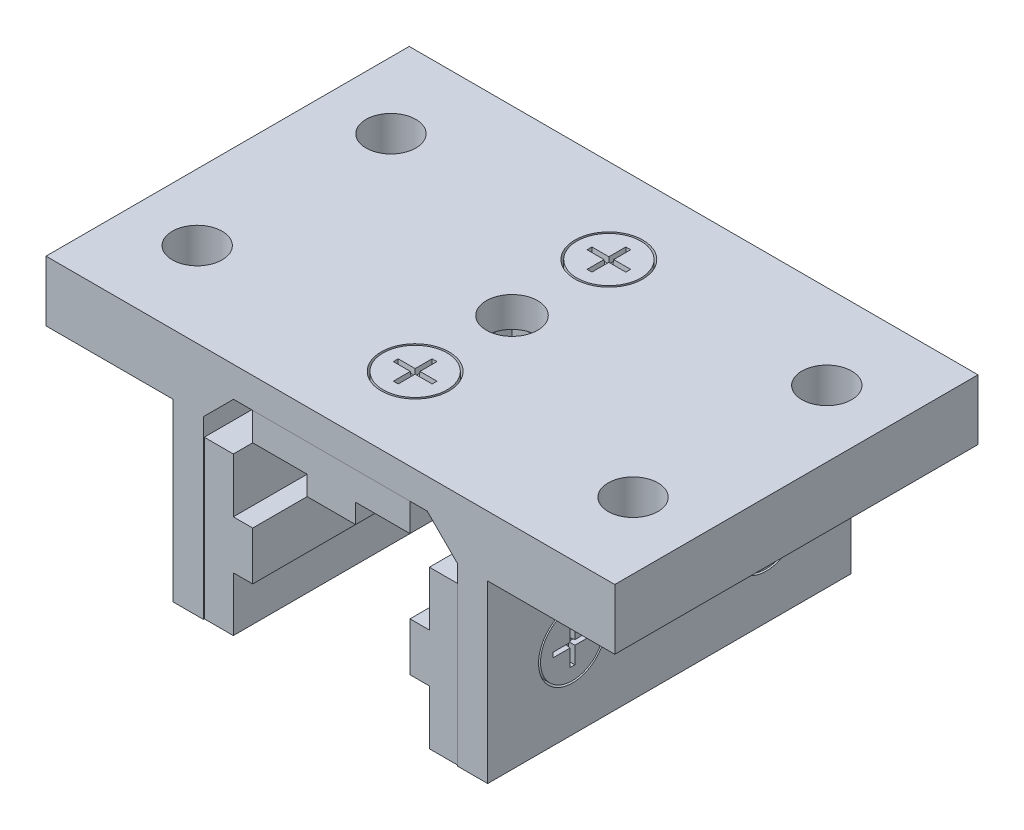
from build123d import *

# Parameters (mm, degrees)
BOSS_EXTRUDE1_DEPTH       = 23.8125
BOSS_EXTRUDE2_DEPTH       = 23.6855
BOSS_EXTRUDE2_2_DEPTH     = 23.6855
SKETCH11_W                = 6.35
SKETCH11_H                = 6.35
CUT_EXTRUDE5_DEPTH        = 50.812205773
SKETCH12_W                = 6.35
SKETCH12_H                = 6.35
CUT_EXTRUDE6_DEPTH        = 38.653683835
SKETCH3_R                 = 4.445
SKETCH3_R_2               = 4.191
CUT_EXTRUDE1_DEPTH        = 1.9812
CUT_EXTRUDE2_DEPTH        = 0.762
CUT_EXTRUDE2_DRAFT        = -5
SKETCH13_R                = 4.445
SKETCH13_R_2              = 4.191
CUT_EXTRUDE_THIN1_DEPTH   = 1.9812
CUT_EXTRUDE7_DEPTH        = 0.762
CUT_EXTRUDE7_DRAFT        = -5
MIRROR4_COPY_1_DEPTH      = 0.762
MIRROR4_COPY_1_DRAFT      = -5
MIRROR3_COPY_1_DEPTH      = 0.762
MIRROR3_COPY_1_DRAFT      = -5
MIRROR3_COPY_2_DEPTH      = 0.762
MIRROR3_COPY_2_DRAFT      = -5
MIRROR3_COPY_3_SKETCH_R   = 4.445
MIRROR3_COPY_3_SKETCH_R_2 = 4.191
MIRROR3_COPY_3_DEPTH      = 1.9812
MIRROR3_COPY_4_DEPTH      = 0.762
MIRROR3_COPY_4_DRAFT      = -5
SKETCH9_R                 = 3.3655
CUT_EXTRUDE4_DEPTH        = 45.153458247
CUT_EXTRUDE8_DEPTH        = 45.153458247
CUT_EXTRUDE8_DEPTH_BACK   = 45.153458247
SKETCH15_R                = 3.3655
TOP_START                 = -23.8125
SKETCH16_W                = 18.6436
SKETCH16_H                = 7.9248
TOP_FLANGE_DEPTH          = 47.625
SKETCH17_R                = 3.2639
TOP_FLANGE_HOLE_DEPTH     = 54.985931352


with BuildPart() as part:
    # Sketch1 → Boss-Extrude1 (new, symmetric)
    with BuildSketch(Plane.XY):
        Polygon((-16.6624, 0), (-16.6624, 23.0124), (-12.7, 26.9748), (12.7, 26.9748), (16.6624, 23.0124), (16.6624, 0), (20.6248, 0), (20.6248, 30.9372), (-20.6248, 30.9372), (-20.6248, 0), align=None)
    extrude(amount=BOSS_EXTRUDE1_DEPTH, both=True)

    # Sketch3 → Cut-Extrude1 (cut)
    with BuildSketch(Plane(origin=(0, 30.9372, 0), x_dir=(1, 0, 0), z_dir=(0, 1, 0))):
        with Locations(Location((0, -12.7, 0), (0, 0, 270))):
            Circle(SKETCH3_R)
        with Locations(Location((0, -12.7, 0), (0, 0, 270))):
            Circle(SKETCH3_R_2, mode=Mode.SUBTRACT)
    cut_extrude1 = extrude(amount=-CUT_EXTRUDE1_DEPTH, mode=Mode.SUBTRACT)


with BuildPart() as body_2:
    # Sketch2 → Boss-Extrude2 (new, symmetric)
    with BuildSketch(Plane.XY):
        Polygon((-12.8524, 13.4874), (-12.8524, 20.6248), (-16.6624, 20.6248), (-16.6624, 0), (-12.8524, 0), (-12.8524, 7.1374), (-10.3124, 7.1374), (-10.3124, 13.4874), align=None)
    extrude(amount=BOSS_EXTRUDE2_DEPTH, both=True)

    # Sketch11 → Cut-Extrude5 (cut, through all)
    with BuildSketch(Plane(origin=(-10.3124, 0, 0), x_dir=(0, 0, -1), z_dir=(1, 0, 0))):
        with Locations((0, 10.3124)):
            Rectangle(SKETCH11_W, SKETCH11_H)
    extrude(amount=-CUT_EXTRUDE5_DEPTH, mode=Mode.SUBTRACT)


with BuildPart() as body_3:
    # Sketch2 → Boss-Extrude2 2 (new, symmetric)
    with BuildSketch(Plane.XY):
        Polygon((-10.3124, 26.9748), (10.3124, 26.9748), (10.3124, 23.1648), (3.175, 23.1648), (3.175, 20.6248), (-3.175, 20.6248), (-3.175, 23.1648), (-10.3124, 23.1648), align=None)
    extrude(amount=BOSS_EXTRUDE2_2_DEPTH, both=True)

    # Sketch12 → Cut-Extrude6 (cut, through all)
    with BuildSketch(Plane.XZ.offset(-20.6248)):
        Rectangle(SKETCH12_W, SKETCH12_H)
    extrude(amount=-CUT_EXTRUDE6_DEPTH, mode=Mode.SUBTRACT)


with BuildPart() as body_4:
    # Mirror1: mirrored copy
    add(body_2.part.mirror(Plane(origin=(0, 0, 0), x_dir=(0, 0, 1), z_dir=(1, 0, 0))))


with BuildPart() as cut_extrude2_tool:
    # Sketch5 → Cut-Extrude2 (with draft: the straight prism first)
    with BuildSketch(Plane(origin=(0, 30.9372, 0), x_dir=(1, 0, 0), z_dir=(0, 1, 0))):
        Polygon((0.3175, -12.3825), (0.3175, -10.16), (-0.3175, -10.16), (-0.3175, -12.3825), (-2.54, -12.3825), (-2.54, -13.0175), (-0.3175, -13.0175), (-0.3175, -15.24), (0.3175, -15.24), (0.3175, -13.0175), (2.54, -13.0175), (2.54, -12.3825), align=None)
    extrude(amount=-CUT_EXTRUDE2_DEPTH)
    # Cut-Extrude2: the draft: its side faces are tilted about the plane it starts from
    cut_extrude2_sides = [cut_extrude2_tool.faces().sort_by_distance(p)[0] for p in [
        (0.3175, 30.5562, 11.27125),
        (0, 30.5562, 10.16),
        (-0.3175, 30.5562, 11.27125),
        (-1.42875, 30.5562, 12.3825),
        (-2.54, 30.5562, 12.7),
        (-1.42875, 30.5562, 13.0175),
        (-0.3175, 30.5562, 14.12875),
        (0, 30.5562, 15.24),
        (0.3175, 30.5562, 14.12875),
        (1.42875, 30.5562, 13.0175),
        (2.54, 30.5562, 12.7),
        (1.42875, 30.5562, 12.3825),
    ]]
    draft(cut_extrude2_sides, Plane(origin=(0, 30.9372, 0), x_dir=(1, 0, 0), z_dir=(0, 1, 0)), CUT_EXTRUDE2_DRAFT)


with BuildPart() as part_1:
    add(part.part)

    # Cut-Extrude2: cut by cut_extrude2_tool
    add(cut_extrude2_tool.part, mode=Mode.SUBTRACT)

    # Sketch13 → Cut-Extrude-Thin1 (cut)
    with BuildSketch(Plane(origin=(20.6248, 0, 0), x_dir=(0, 0, -1), z_dir=(1, 0, 0))):
        with Locations((-12.7, 10.3124)):
            Circle(SKETCH13_R)
        with Locations((-12.7, 10.3124)):
            Circle(SKETCH13_R_2, mode=Mode.SUBTRACT)
    cut_extrude_thin1 = extrude(amount=-CUT_EXTRUDE_THIN1_DEPTH, mode=Mode.SUBTRACT)


with BuildPart() as cut_extrude7_tool:
    # Sketch14 → Cut-Extrude7 (with draft: the straight prism first)
    with BuildSketch(Plane(origin=(20.6248, 0, 0), x_dir=(0, 0, -1), z_dir=(1, 0, 0))):
        Polygon((-13.0175, 9.9949), (-13.0175, 7.7724), (-12.3825, 7.7724), (-12.3825, 9.9949), (-10.16, 9.9949), (-10.16, 10.6299), (-12.3825, 10.6299), (-12.3825, 12.8524), (-13.0175, 12.8524), (-13.0175, 10.6299), (-15.24, 10.6299), (-15.24, 9.9949), align=None)
    extrude(amount=-CUT_EXTRUDE7_DEPTH)
    # Cut-Extrude7: the draft: its side faces are tilted about the plane it starts from
    cut_extrude7_sides = [cut_extrude7_tool.faces().sort_by_distance(p)[0] for p in [
        (20.2438, 8.88365, 13.0175),
        (20.2438, 7.7724, 12.7),
        (20.2438, 8.88365, 12.3825),
        (20.2438, 9.9949, 11.27125),
        (20.2438, 10.3124, 10.16),
        (20.2438, 10.6299, 11.27125),
        (20.2438, 11.74115, 12.3825),
        (20.2438, 12.8524, 12.7),
        (20.2438, 11.74115, 13.0175),
        (20.2438, 10.6299, 14.12875),
        (20.2438, 10.3124, 15.24),
        (20.2438, 9.9949, 14.12875),
    ]]
    draft(cut_extrude7_sides, Plane(origin=(20.6248, 0, 0), x_dir=(0, 0, -1), z_dir=(1, 0, 0)), CUT_EXTRUDE7_DRAFT)


with BuildPart() as part_2:
    add(part_1.part)

    # Cut-Extrude7: cut by cut_extrude7_tool
    add(cut_extrude7_tool.part, mode=Mode.SUBTRACT)

    # Mirror4: Cut-Extrude-Thin1 across plane
    add(cut_extrude_thin1.mirror(Plane(origin=(0, 0, 0), x_dir=(0, 0, 1), z_dir=(1, 0, 0))), mode=Mode.SUBTRACT)


with BuildPart() as mirror4_copy_1_tool:
    # Mirror4 copy 1 sketch → Mirror4 copy 1 (with draft: the straight prism first)
    with BuildSketch(Plane(origin=(-20.6248, 0, 0), x_dir=(0, 0, -1), z_dir=(-1, 0, 0))):
        Polygon((-13.0175, -9.9949), (-13.0175, -7.7724), (-12.3825, -7.7724), (-12.3825, -9.9949), (-10.16, -9.9949), (-10.16, -10.6299), (-12.3825, -10.6299), (-12.3825, -12.8524), (-13.0175, -12.8524), (-13.0175, -10.6299), (-15.24, -10.6299), (-15.24, -9.9949), align=None)
    extrude(amount=-MIRROR4_COPY_1_DEPTH)
    # Mirror4 copy 1: the draft: its side faces are tilted about the plane it starts from
    mirror4_copy_1_sides = [mirror4_copy_1_tool.faces().sort_by_distance(p)[0] for p in [
        (-20.2438, 8.88365, 13.0175),
        (-20.2438, 7.7724, 12.7),
        (-20.2438, 8.88365, 12.3825),
        (-20.2438, 9.9949, 11.27125),
        (-20.2438, 10.3124, 10.16),
        (-20.2438, 10.6299, 11.27125),
        (-20.2438, 11.74115, 12.3825),
        (-20.2438, 12.8524, 12.7),
        (-20.2438, 11.74115, 13.0175),
        (-20.2438, 10.6299, 14.12875),
        (-20.2438, 10.3124, 15.24),
        (-20.2438, 9.9949, 14.12875),
    ]]
    draft(mirror4_copy_1_sides, Plane(origin=(-20.6248, 0, 0), x_dir=(0, 0, -1), z_dir=(-1, 0, 0)), MIRROR4_COPY_1_DRAFT)


with BuildPart() as part_3:
    add(part_2.part)

    # Mirror4 copy 1: cut by mirror4_copy_1_tool
    add(mirror4_copy_1_tool.part, mode=Mode.SUBTRACT)

    # Mirror3: Cut-Extrude1, Cut-Extrude-Thin1 across plane
    add(cut_extrude1.mirror(Plane.XY), mode=Mode.SUBTRACT)
    add(cut_extrude_thin1.mirror(Plane.XY), mode=Mode.SUBTRACT)


with BuildPart() as mirror3_copy_1_tool:
    # Mirror3 copy 1 sketch → Mirror3 copy 1 (with draft: the straight prism first)
    with BuildSketch(Plane(origin=(0, 30.9372, 0), x_dir=(1, 0, 0), z_dir=(0, 1, 0))):
        Polygon((0.3175, 12.3825), (0.3175, 10.16), (-0.3175, 10.16), (-0.3175, 12.3825), (-2.54, 12.3825), (-2.54, 13.0175), (-0.3175, 13.0175), (-0.3175, 15.24), (0.3175, 15.24), (0.3175, 13.0175), (2.54, 13.0175), (2.54, 12.3825), align=None)
    extrude(amount=-MIRROR3_COPY_1_DEPTH)
    # Mirror3 copy 1: the draft: its side faces are tilted about the plane it starts from
    mirror3_copy_1_sides = [mirror3_copy_1_tool.faces().sort_by_distance(p)[0] for p in [
        (0.3175, 30.5562, -11.27125),
        (0, 30.5562, -10.16),
        (-0.3175, 30.5562, -11.27125),
        (-1.42875, 30.5562, -12.3825),
        (-2.54, 30.5562, -12.7),
        (-1.42875, 30.5562, -13.0175),
        (-0.3175, 30.5562, -14.12875),
        (0, 30.5562, -15.24),
        (0.3175, 30.5562, -14.12875),
        (1.42875, 30.5562, -13.0175),
        (2.54, 30.5562, -12.7),
        (1.42875, 30.5562, -12.3825),
    ]]
    draft(mirror3_copy_1_sides, Plane(origin=(0, 30.9372, 0), x_dir=(1, 0, 0), z_dir=(0, 1, 0)), MIRROR3_COPY_1_DRAFT)


with BuildPart() as part_4:
    add(part_3.part)

    # Mirror3 copy 1: cut by mirror3_copy_1_tool
    add(mirror3_copy_1_tool.part, mode=Mode.SUBTRACT)


with BuildPart() as mirror3_copy_2_tool:
    # Mirror3 copy 2 sketch → Mirror3 copy 2 (with draft: the straight prism first)
    with BuildSketch(Plane(origin=(20.6248, 0, 0), x_dir=(0, 0, 1), z_dir=(1, 0, 0))):
        Polygon((-13.0175, -9.9949), (-13.0175, -7.7724), (-12.3825, -7.7724), (-12.3825, -9.9949), (-10.16, -9.9949), (-10.16, -10.6299), (-12.3825, -10.6299), (-12.3825, -12.8524), (-13.0175, -12.8524), (-13.0175, -10.6299), (-15.24, -10.6299), (-15.24, -9.9949), align=None)
    extrude(amount=-MIRROR3_COPY_2_DEPTH)
    # Mirror3 copy 2: the draft: its side faces are tilted about the plane it starts from
    mirror3_copy_2_sides = [mirror3_copy_2_tool.faces().sort_by_distance(p)[0] for p in [
        (20.2438, 8.88365, -13.0175),
        (20.2438, 7.7724, -12.7),
        (20.2438, 8.88365, -12.3825),
        (20.2438, 9.9949, -11.27125),
        (20.2438, 10.3124, -10.16),
        (20.2438, 10.6299, -11.27125),
        (20.2438, 11.74115, -12.3825),
        (20.2438, 12.8524, -12.7),
        (20.2438, 11.74115, -13.0175),
        (20.2438, 10.6299, -14.12875),
        (20.2438, 10.3124, -15.24),
        (20.2438, 9.9949, -14.12875),
    ]]
    draft(mirror3_copy_2_sides, Plane(origin=(20.6248, 0, 0), x_dir=(0, 0, 1), z_dir=(1, 0, 0)), MIRROR3_COPY_2_DRAFT)


with BuildPart() as part_5:
    add(part_4.part)

    # Mirror3 copy 2: cut by mirror3_copy_2_tool
    add(mirror3_copy_2_tool.part, mode=Mode.SUBTRACT)

    # Mirror3 copy 3 sketch → Mirror3 copy 3 (cut)
    with BuildSketch(Plane.ZY.offset(20.6248)):
        with Locations((-12.7, 10.3124)):
            Circle(MIRROR3_COPY_3_SKETCH_R)
        with Locations((-12.7, 10.3124)):
            Circle(MIRROR3_COPY_3_SKETCH_R_2, mode=Mode.SUBTRACT)
    extrude(amount=-MIRROR3_COPY_3_DEPTH, mode=Mode.SUBTRACT)


with BuildPart() as mirror3_copy_4_tool:
    # Mirror3 copy 4 sketch → Mirror3 copy 4 (with draft: the straight prism first)
    with BuildSketch(Plane.ZY.offset(20.6248)):
        Polygon((-13.0175, 9.9949), (-13.0175, 7.7724), (-12.3825, 7.7724), (-12.3825, 9.9949), (-10.16, 9.9949), (-10.16, 10.6299), (-12.3825, 10.6299), (-12.3825, 12.8524), (-13.0175, 12.8524), (-13.0175, 10.6299), (-15.24, 10.6299), (-15.24, 9.9949), align=None)
    extrude(amount=-MIRROR3_COPY_4_DEPTH)
    # Mirror3 copy 4: the draft: its side faces are tilted about the plane it starts from
    mirror3_copy_4_sides = [mirror3_copy_4_tool.faces().sort_by_distance(p)[0] for p in [
        (-20.2438, 8.88365, -13.0175),
        (-20.2438, 7.7724, -12.7),
        (-20.2438, 8.88365, -12.3825),
        (-20.2438, 9.9949, -11.27125),
        (-20.2438, 10.3124, -10.16),
        (-20.2438, 10.6299, -11.27125),
        (-20.2438, 11.74115, -12.3825),
        (-20.2438, 12.8524, -12.7),
        (-20.2438, 11.74115, -13.0175),
        (-20.2438, 10.6299, -14.12875),
        (-20.2438, 10.3124, -15.24),
        (-20.2438, 9.9949, -14.12875),
    ]]
    draft(mirror3_copy_4_sides, Plane.ZY.offset(20.6248), MIRROR3_COPY_4_DRAFT)


with BuildPart() as part_6:
    add(part_5.part)

    # Mirror3 copy 4: cut by mirror3_copy_4_tool
    add(mirror3_copy_4_tool.part, mode=Mode.SUBTRACT)

    # Sketch9 → Cut-Extrude4 (cut, through all)
    with BuildSketch(Plane(origin=(0, 30.9372, 0), x_dir=(1, 0, 0), z_dir=(0, 1, 0))):
        with Locations(Location((0, 0, 0), (0, 0, 270))):
            Circle(SKETCH9_R)
    extrude(amount=-CUT_EXTRUDE4_DEPTH, mode=Mode.SUBTRACT)

    # Sketch15 → Cut-Extrude8 (cut, two sides: drawn at the far end of the back side and taken through both)
    with BuildSketch(Plane(origin=(0, 0, 0), x_dir=(0, 0, -1), z_dir=(1, 0, 0)).offset(-CUT_EXTRUDE8_DEPTH_BACK)):
        with Locations((0, 10.3124)):
            Circle(SKETCH15_R)
    extrude(amount=CUT_EXTRUDE8_DEPTH + CUT_EXTRUDE8_DEPTH_BACK, mode=Mode.SUBTRACT)

    # Sketch16 → Top Flange (add)
    with BuildSketch(Plane.XY.offset(TOP_START)):
        with Locations((-27.9654, 26.9748)):
            Rectangle(SKETCH16_W, SKETCH16_H)
        with Locations((27.9654, 26.9748)):
            Rectangle(SKETCH16_W, SKETCH16_H)
    extrude(amount=TOP_FLANGE_DEPTH)

    # Sketch17 → Top Flange Hole (cut, through all)
    with BuildSketch(Plane(origin=(0, 30.9372, 0), x_dir=(1, 0, 0), z_dir=(0, 1, 0))):
        with Locations(Location((28.575, 12.7, 0), (0, 0, 270))):
            Circle(SKETCH17_R)
        with Locations(Location((28.575, -12.7, 0), (0, 0, 270))):
            Circle(SKETCH17_R)
        with Locations(Location((-28.575, 12.7, 0), (0, 0, 270))):
            Circle(SKETCH17_R)
        with Locations(Location((-28.575, -12.7, 0), (0, 0, 270))):
            Circle(SKETCH17_R)
    extrude(amount=-TOP_FLANGE_HOLE_DEPTH, mode=Mode.SUBTRACT)


solid = Compound([body_2.part, body_3.part, body_4.part, part_6.part])
